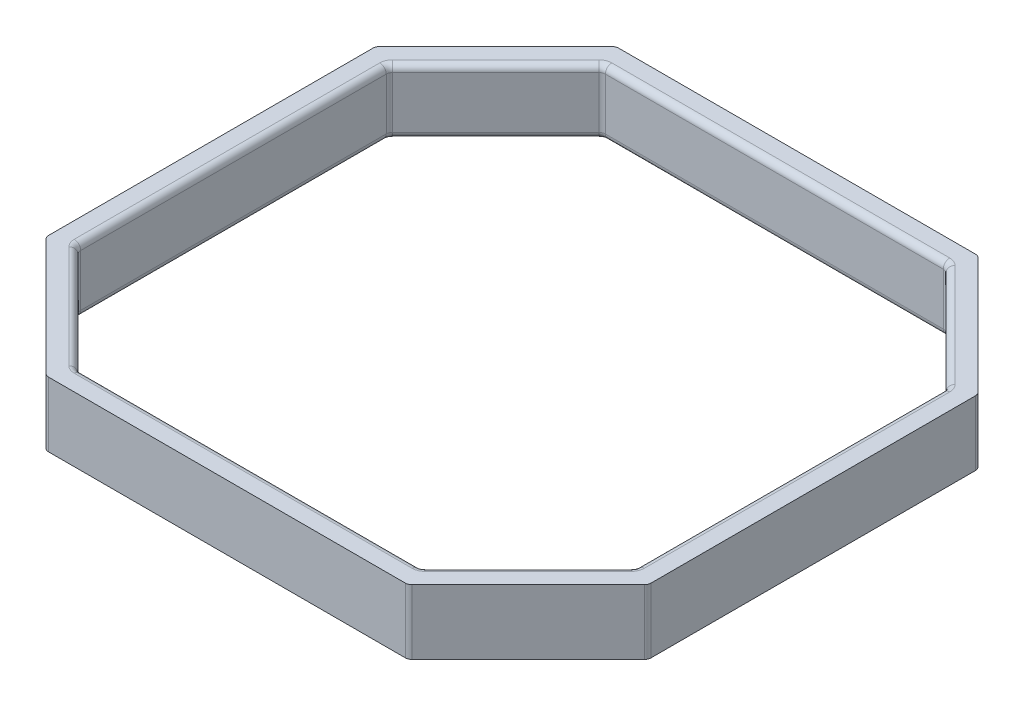
from build123d import *

# Parameters (mm, degrees)
BOSS_EXTRUDE1_DEPTH = 10
FILLET1_R           = 1


with BuildPart() as part:
    # Sketch1 → Boss-Extrude1 (new body)
    with BuildSketch(Plane(origin=(0, 0, 0), x_dir=(1, 0, 0), z_dir=(0, 1, 0))):
        Polygon((-46.5, 25.449747468), (-27.949747468, 44), (27.949747468, 44), (46.5, 25.449747468), (46.5, -25.449747468), (27.949747468, -44), (-27.949747468, -44), (-46.5, -25.449747468), align=None)
        Polygon((-43, 24), (-26.5, 40.5), (26.5, 40.5), (43, 24), (43, -24), (26.5, -40.5), (-26.5, -40.5), (-43, -24), align=None, mode=Mode.SUBTRACT)
    extrude(amount=BOSS_EXTRUDE1_DEPTH)

    # Fillet1
    fillet1_edges = [part.edges().sort_by_distance(p)[0] for p in [
        (-43, 10, 0),
        (-43, 0, 0),
        (0, 10, -40.5),
        (0, 0, -40.5),
        (43, 10, 0),
        (43, 0, 0),
        (0, 10, 40.5),
        (0, 0, 40.5),
        (-26.5, 5, 40.5),
        (-34.75, 10, 32.25),
        (-43, 5, 24),
        (-34.75, 0, 32.25),
        (-43, 5, -24),
        (-34.75, 10, -32.25),
        (-26.5, 5, -40.5),
        (-34.75, 0, -32.25),
        (26.5, 5, -40.5),
        (34.75, 10, -32.25),
        (43, 5, -24),
        (34.75, 0, -32.25),
        (43, 5, 24),
        (34.75, 10, 32.25),
        (26.5, 5, 40.5),
        (34.75, 0, 32.25),
        (-46.5, 5, -25.449747468),
        (-27.949747468, 5, -44),
        (-46.5, 5, 25.449747468),
        (-27.949747468, 5, 44),
        (27.949747468, 5, 44),
        (46.5, 5, 25.449747468),
        (46.5, 5, -25.449747468),
        (27.949747468, 5, -44),
    ]]
    fillet(fillet1_edges, radius=FILLET1_R)


solid = part.part
